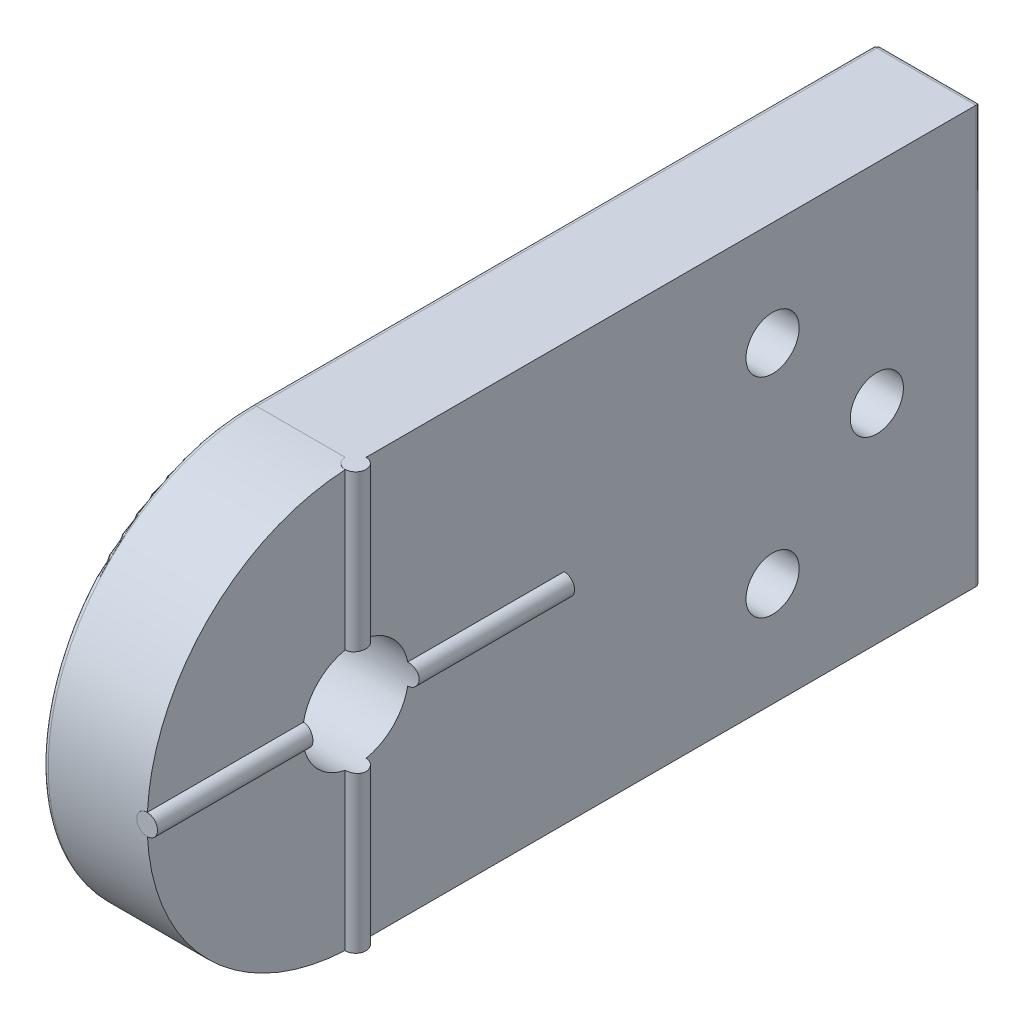
from build123d import *
from build123d.topology import SkipClean

# Parameters (mm, degrees)
BOSS_EXTRUDE1_DEPTH = 10
SKETCH3_W           = 1
SKETCH3_H           = 40
SKETCH4_W           = 40
SKETCH4_H           = 1
SKETCH7_R           = 5.1
CUT_EXTRUDE3_DEPTH  = 65.195015431
FILLET3_R           = 0.5
FILLET4_R           = 0.5
SKETCH6_R           = 2.55
CUT_EXTRUDE4_DEPTH  = 65.195015432


with BuildPart() as part:
    # Sketch1 → Boss-Extrude1 (new body)
    with BuildSketch(Plane(origin=(0, 0, 0), x_dir=(0, 0, -1), z_dir=(1, 0, 0))):
        with BuildLine():
            Line((0, 20), (60, 20))
            Line((60, 20), (60, -20))
            Line((60, -20), (0, -20))
            ThreePointArc((0, -20), (-20, 0), (0, 20))
        make_face()
    extrude(amount=BOSS_EXTRUDE1_DEPTH)

    # Sketch3 → Revolve-Thin1 (revolve)
    with BuildSketch(Plane(origin=(10, 0, 0), x_dir=(0, 0, -1), z_dir=(1, 0, 0))):
        with Locations((0.5, 0)):
            Rectangle(SKETCH3_W, SKETCH3_H)
    revolve(axis=Axis((10, 20, 0), (0, -1, 0)))

    # Sketch4 → Revolve-Thin2 (revolve)
    with SkipClean():  # the faces are left unmerged after this step: merging them gives an invalid solid
        with BuildSketch(Plane(origin=(10, 0, 0), x_dir=(0, 0, -1), z_dir=(1, 0, 0))):
            with Locations((0, 0.5)):
                Rectangle(SKETCH4_W, SKETCH4_H)
        revolve(axis=Axis((10, 0, 20), (0, 0, -1)))

    # Sketch7 → Cut-Extrude3 (cut, through all)
    with SkipClean():  # the faces are left unmerged after this step: merging them gives an invalid solid
        with BuildSketch(Plane.ZY):
            Circle(SKETCH7_R)
        extrude(amount=-CUT_EXTRUDE3_DEPTH, mode=Mode.SUBTRACT)

    # Fillet3
    fillet3_edges = [part.edges().sort_by_distance(p)[0] for p in [
        (0, 20, -30),
        (0, 0, -60),
        (0, -20, -30),
        (0, 0, -5.1),
        (0, 0, 20),
    ]]
    fillet(fillet3_edges, radius=FILLET3_R)

    # Fillet4
    # the kernel refuses this fillet: 0.5 mm, written as the material it takes off along each edge
    with BuildSketch(Plane(origin=(0.5, 19.5, -59.5), x_dir=(0, 0, -1), z_dir=(0, 1, 0))) as fillet4_piece_1_section:
        Polygon((0, 0), (FILLET4_R, 0), (FILLET4_R, FILLET4_R), (0, FILLET4_R), align=None)
    fillet4_piece_1 = extrude(amount=FILLET4_R, mode=Mode.PRIVATE)
    fillet4_piece_1 = fillet4_piece_1 - Plane(origin=(0.5, 19.5, -59.5), x_dir=(0.7071067811865475, 0, 0.7071067811865475), z_dir=(0, 1, 0)) * Sphere(FILLET4_R, mode=Mode.PRIVATE)
    add(fillet4_piece_1, mode=Mode.SUBTRACT)
    with BuildSketch(Plane(origin=(0.5, -19.5, -59.5), x_dir=(0, -1, 0), z_dir=(0, 0, -1))) as fillet4_piece_2_section:
        Polygon((0, 0), (FILLET4_R, 0), (FILLET4_R, FILLET4_R), (0, FILLET4_R), align=None)
    fillet4_piece_2 = extrude(amount=FILLET4_R, mode=Mode.PRIVATE)
    fillet4_piece_2 = fillet4_piece_2 - Plane(origin=(0.5, -19.5, -59.5), x_dir=(0.7071067811865475, 0.7071067811865475, 0), z_dir=(0, 0, -1)) * Sphere(FILLET4_R, mode=Mode.PRIVATE)
    add(fillet4_piece_2, mode=Mode.SUBTRACT)
    with BuildSketch(Plane(origin=(10, 21.25, -60), x_dir=(-1, 0, 0), z_dir=(0, -1, 0))) as fillet4_piece_3:
        with BuildLine():
            CenterArc((FILLET4_R, -FILLET4_R), FILLET4_R, 90, 90)
            Line((0, -FILLET4_R), (0, 0))
            Line((0, 0), (FILLET4_R, 0))
        make_face()
    extrude(amount=42.5, mode=Mode.SUBTRACT)
    with BuildSketch(Plane(origin=(0.5, 20, -60), x_dir=(0, 0, 1), z_dir=(1, 0, 0)), Plane(origin=(0.5, -20, -60), x_dir=(0, 1, 0), z_dir=(1, 0, 0))) as fillet4_piece_4:
        with BuildLine():
            CenterArc((FILLET4_R, FILLET4_R), FILLET4_R, 180, 90)
            Line((0, FILLET4_R), (0, 0))
            Line((0, 0), (FILLET4_R, 0))
        make_face()
    extrude(amount=10.75, mode=Mode.SUBTRACT)

    # Sketch6 → Cut-Extrude4 (cut, through all)
    with SkipClean():  # the faces are left unmerged after this step: merging them gives an invalid solid
        with BuildSketch(Plane.ZY):
            with Locations((-40, 10)):
                Circle(SKETCH6_R)
            with Locations((-50, 0)):
                Circle(SKETCH6_R)
            with Locations((-40, -10)):
                Circle(SKETCH6_R)
        extrude(amount=-CUT_EXTRUDE4_DEPTH, mode=Mode.SUBTRACT)


solid = part.part
